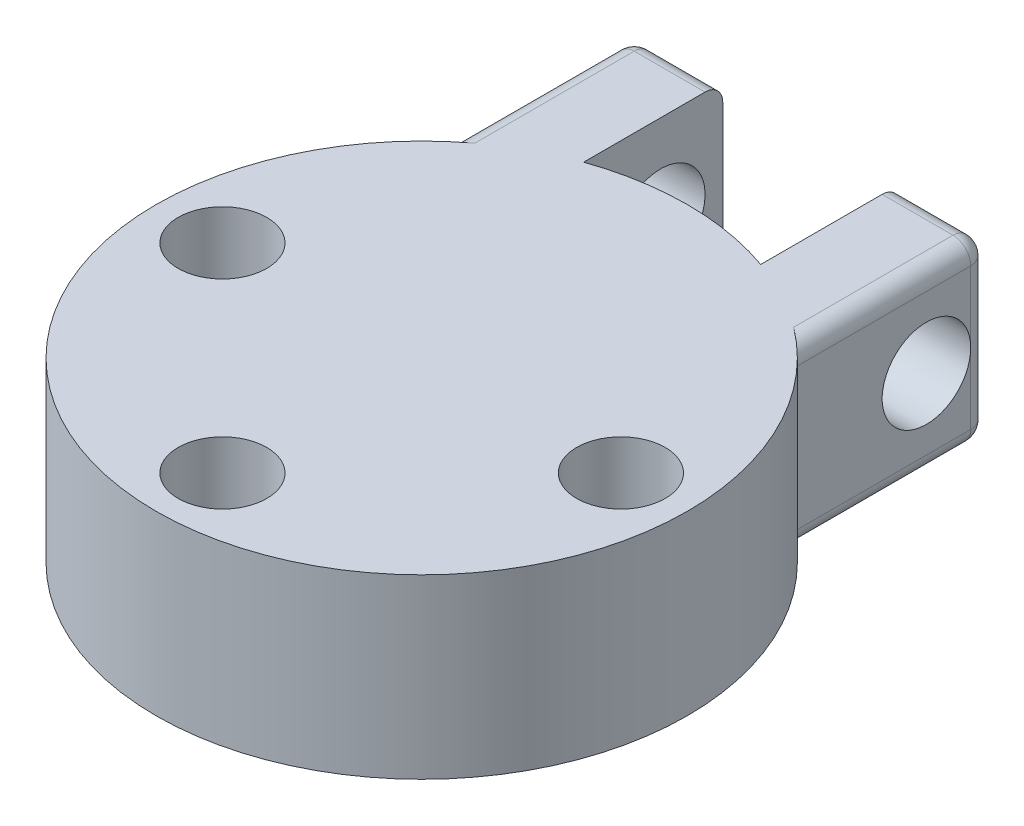
from build123d import *

# Parameters (mm, degrees)
BOSS_EXTRUDE1_DEPTH             = 10
F_5_0MM_DOWEL_HOLE1_D           = 5
F_5_0MM_DOWEL_HOLE1_CSINK_D     = 5.05
F_5_0MM_DOWEL_HOLE1_CSINK_ANGLE = 90
SKETCH5_W                       = 10
SKETCH5_H                       = 7.5
CUT_EXTRUDE1_DEPTH              = 20
SKETCH6_R                       = 7.5
CUT_EXTRUDE2_DEPTH              = 7.5
CHAMFER1_SIZE                   = 2
FILLET1_R                       = 1
F_5_0MM_DOWEL_HOLE2_D           = 5
F_5_0MM_DOWEL_HOLE2_DEPTH       = 10
F_5_0MM_DOWEL_HOLE2_TIP         = 1.502151548


with BuildPart() as part:
    # Sketch1 → Boss-Extrude1 (new body)
    with BuildSketch(Plane(origin=(0, 0, 0), x_dir=(1, 0, 0), z_dir=(0, 1, 0))):
        with BuildLine():
            Line((-5, 14.142135624), (-5, 22))
            Line((-5, 22), (-10, 22))
            Line((-10, 22), (-10, 11.180339887))
            ThreePointArc((-10, 11.180339887), (0, -15), (10, 11.180339887))
            Line((10, 11.180339887), (10, 22))
            Line((10, 22), (5, 22))
            Line((5, 22), (5, 14.142135624))
            ThreePointArc((5, 14.142135624), (0, 15), (-5, 14.142135624))
        make_face()
    extrude(amount=BOSS_EXTRUDE1_DEPTH)

    # Ø5.0mm Dowel Hole1 (through all)
    with Locations(Plane.ZY.offset(10)):
        with Locations((-18.5, 5)):
            CounterSinkHole(F_5_0MM_DOWEL_HOLE1_D / 2, F_5_0MM_DOWEL_HOLE1_CSINK_D / 2, counter_sink_angle=F_5_0MM_DOWEL_HOLE1_CSINK_ANGLE)

    # Sketch5 → Cut-Extrude1 (cut)
    with BuildSketch(Plane(origin=(0, 0, -22), x_dir=(-1, 0, 0), z_dir=(0, 0, -1))):
        with Locations((0, 3.75)):
            Rectangle(SKETCH5_W, SKETCH5_H)
    extrude(amount=-CUT_EXTRUDE1_DEPTH, mode=Mode.SUBTRACT)

    # Sketch6 → Cut-Extrude2 (cut)
    with BuildSketch(Plane.XZ):
        Circle(SKETCH6_R)
    extrude(amount=-CUT_EXTRUDE2_DEPTH, mode=Mode.SUBTRACT)

    # Chamfer1
    chamfer1_edges = [part.edges().sort_by_distance(p)[0] for p in [
        (0, 7.5, -15),
    ]]
    chamfer(chamfer1_edges, length=CHAMFER1_SIZE)

    # Fillet1
    fillet1_edges = [part.edges().sort_by_distance(p)[0] for p in [
        (-10, 0, -16.590169944),
        (-7.5, 0, -22),
        (-7.5, 10, -22),
        (10, 5, -22),
        (-10, 5, -22),
        (-10, 10, -16.590169944),
        (10, 10, -16.590169944),
        (7.5, 10, -22),
        (7.5, 0, -22),
        (10, 0, -16.590169944),
    ]]
    fillet(fillet1_edges, radius=FILLET1_R - 0.0001)  # a hair under: the kernel refuses the full size

    # Ø5.0mm Dowel Hole2
    with Locations(Plane(origin=(0, 0, 0), x_dir=(-1, 0, 0), z_dir=(0, -1, 0))):
        with Locations((-11.25, 0), (0, -11.25), (11.25, 0)):
            Hole(F_5_0MM_DOWEL_HOLE2_D / 2, depth=F_5_0MM_DOWEL_HOLE2_DEPTH)
            with Locations((0, 0, -(F_5_0MM_DOWEL_HOLE2_DEPTH + F_5_0MM_DOWEL_HOLE2_TIP / 2))):  # 118° drill point
                Cone(0, F_5_0MM_DOWEL_HOLE2_D / 2, F_5_0MM_DOWEL_HOLE2_TIP, mode=Mode.SUBTRACT)


solid = part.part
